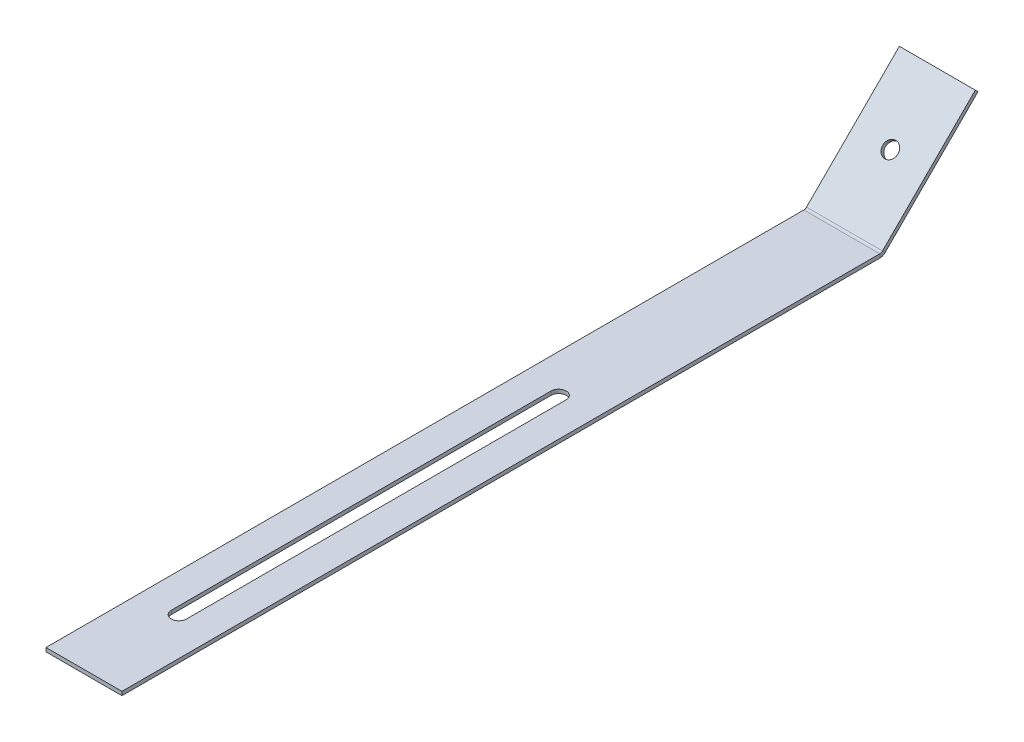
from build123d import *

# Parameters (mm, degrees)
BASE_FLANGE1_DEPTH = 40
SKETCH7_R          = 4
CUT_EXTRUDE1_DEPTH = 2
CUT_EXTRUDE2_DEPTH = 2


# Sheet-metal steps are written as plain solids
with BuildPart() as part:
    # Sketch1 → Base-Flange1 (new body)
    with BuildSketch(Plane(origin=(0, 0, 0), x_dir=(0, 0, -1), z_dir=(1, 0, 0))):
        with BuildLine():
            Line((0, 0), (399.171572875, 0))
            ThreePointArc((399.171572875, 0), (399.93693974, 0.152240935), (400.585786438, 0.585786438))
            Line((400.585786438, 0.585786438), (449.497474683, 49.497474683))
            Line((449.497474683, 49.497474683), (450.911688245, 48.083261121))
            Line((450.911688245, 48.083261121), (402, -0.828427125))
            ThreePointArc((402, -0.828427125), (400.702306605, -1.69551813), (399.171572875, -2))
            Line((399.171572875, -2), (0, -2))
            Line((0, -2), (0, 0))
        make_face()
    extrude(amount=BASE_FLANGE1_DEPTH)

    # Sketch7 → Cut-Extrude1 (cut)
    with BuildSketch(Plane(origin=(0, -200, -200), x_dir=(1, 0, 0), z_dir=(0, 0.7071067811865456, 0.7071067811865496))):
        with Locations(Location((20, 317.842712475, 0), (0, 0, 270))):
            Circle(SKETCH7_R)
    extrude(amount=-CUT_EXTRUDE1_DEPTH, mode=Mode.SUBTRACT)

    # Sketch8 → Cut-Extrude2 (cut)
    with BuildSketch(Plane(origin=(0, 0, 0), x_dir=(1, 0, 0), z_dir=(0, 1, 0))):
        with BuildLine():
            Line((24, 50), (24, 250))
            ThreePointArc((24, 250), (20, 254), (16, 250))
            Line((16, 250), (16, 50))
            ThreePointArc((16, 50), (20, 46), (24, 50))
        make_face()
    extrude(amount=-CUT_EXTRUDE2_DEPTH, mode=Mode.SUBTRACT)


solid = part.part
